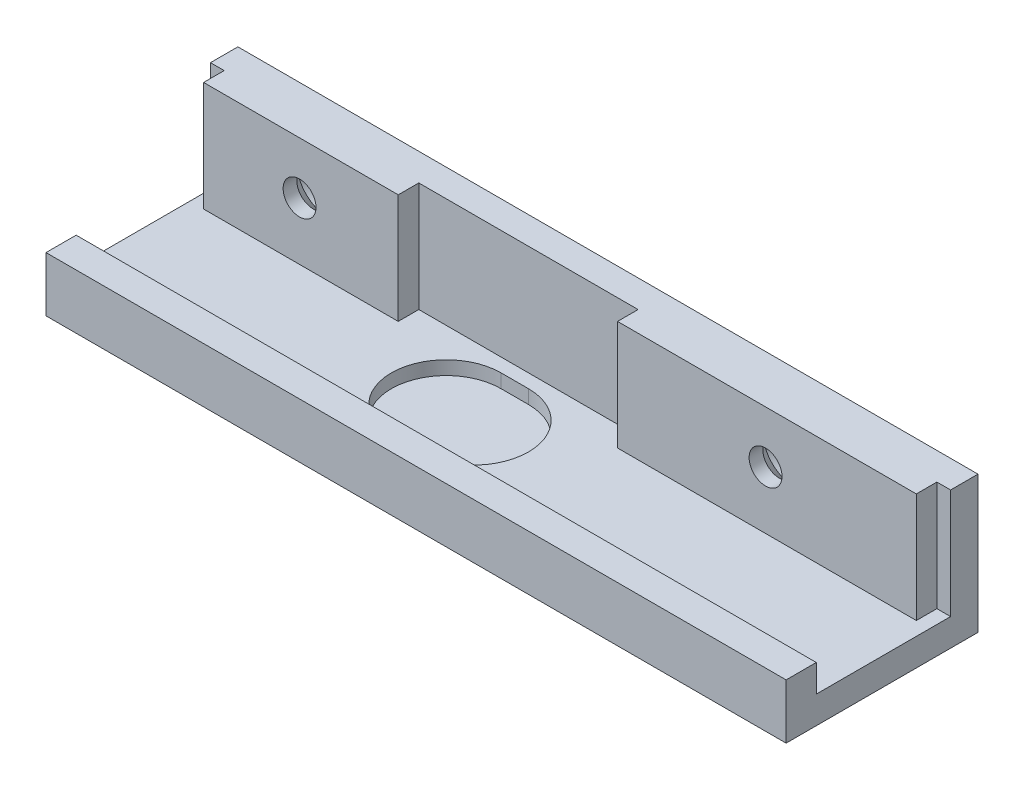
from build123d import *

# Parameters (mm, degrees)
SKETCH2_W                           = 68.58
SKETCH2_H                           = 17.78
BOSS_EXTRUDE1_DEPTH                 = 2.54
SKETCH3_W                           = 68.58
SKETCH3_H                           = 2.54
BOSS_EXTRUDE2_DEPTH                 = 2.54
BOSS_EXTRUDE3_DEPTH                 = 10.16
SKETCH5_R                           = 1.524
CUT_EXTRUDE1_DEPTH                  = 72.009355898
CUT_EXTRUDE2_START                  = -3.81
SKETCH6_R                           = 2.921
CUT_EXTRUDE2_DEPTH                  = 68.199355898
CHAMFER1_SIZE                       = 2.54
CUT_EXTRUDE3_DEPTH                  = 1.27
SKETCH8_W                           = 68.58
SKETCH8_H                           = 2.54
EXTRA_WIDTH_FOR_MIRRORED_PART_DEPTH = 0.254


with BuildPart() as part:
    # Sketch2 → Boss-Extrude1 (new body)
    with BuildSketch(Plane(origin=(0, 0, 0), x_dir=(1, 0, 0), z_dir=(0, 1, 0))):
        with Locations((34.29, -8.89)):
            Rectangle(SKETCH2_W, SKETCH2_H)
    extrude(amount=BOSS_EXTRUDE1_DEPTH)

    # Sketch3 → Boss-Extrude2 (add)
    with BuildSketch(Plane(origin=(0, 2.54, 0), x_dir=(1, 0, 0), z_dir=(0, 1, 0))):
        with Locations((34.29, -16.51)):
            Rectangle(SKETCH3_W, SKETCH3_H)
    extrude(amount=BOSS_EXTRUDE2_DEPTH)

    # Sketch4 → Boss-Extrude3 (add)
    with BuildSketch(Plane(origin=(0, 2.54, 0), x_dir=(1, 0, 0), z_dir=(0, 1, 0))):
        Polygon((0, 0), (68.58, 0), (68.58, -2.54), (67.31, -2.54), (67.31, -4.445), (39.624, -4.445), (39.624, -2.54), (19.304, -2.54), (19.304, -4.445), (1.27, -4.445), (1.27, -2.54), (0, -2.54), align=None)
    extrude(amount=BOSS_EXTRUDE3_DEPTH)

    # Sketch5 → Cut-Extrude1 (cut, through all)
    with BuildSketch(Plane.XY.offset(4.445)):
        with Locations((10.16, 7.874)):
            Circle(SKETCH5_R)
        with Locations((53.34, 7.874)):
            Circle(SKETCH5_R)
    extrude(amount=-CUT_EXTRUDE1_DEPTH, mode=Mode.SUBTRACT)

    # Sketch6 → Cut-Extrude2 (cut, through all)
    with BuildSketch(Plane.XY.offset(4.445).offset(CUT_EXTRUDE2_START)):
        with Locations((10.16, 7.874)):
            Circle(SKETCH6_R)
        with Locations((53.34, 7.874)):
            Circle(SKETCH6_R)
    extrude(amount=-CUT_EXTRUDE2_DEPTH, mode=Mode.SUBTRACT)

    # Chamfer1
    # the kernel refuses this chamfer: 2.54 mm, written as the material it takes off along each edge
    with BuildSketch(Plane(origin=(53.34, 7.874, 0.635), x_dir=(1, 0, 0), z_dir=(0, -1, 0))) as chamfer1_piece_1_section:
        Polygon((1.524 + CHAMFER1_SIZE, 0), (1.524, CHAMFER1_SIZE), (1.524, 0), align=None)
    chamfer1_piece_1 = revolve(axis=Axis((53.34, 7.874, 0.635), (0, 0, 1)), mode=Mode.PRIVATE)
    chamfer1_piece_1 = chamfer1_piece_1 & Plane(origin=(53.34, 7.874, 2.488878995), x_dir=(1, 0, 0), z_dir=(0, 0, 1)) * Cylinder(2.921, 17, mode=Mode.PRIVATE)
    add(chamfer1_piece_1, mode=Mode.SUBTRACT)
    with BuildSketch(Plane(origin=(10.16, 7.874, 0.635), x_dir=(1, 0, 0), z_dir=(0, -1, 0))) as chamfer1_piece_2_section:
        Polygon((1.524 + CHAMFER1_SIZE, 0), (1.524, CHAMFER1_SIZE), (1.524, 0), align=None)
    chamfer1_piece_2 = revolve(axis=Axis((10.16, 7.874, 0.635), (0, 0, 1)), mode=Mode.PRIVATE)
    chamfer1_piece_2 = chamfer1_piece_2 & Plane(origin=(10.16, 7.874, 2.488878995), x_dir=(1, 0, 0), z_dir=(0, 0, 1)) * Cylinder(2.921, 17, mode=Mode.PRIVATE)
    add(chamfer1_piece_2, mode=Mode.SUBTRACT)

    # Sketch7 → Cut-Extrude3 (cut)
    with BuildSketch(Plane(origin=(0, 2.54, 0), x_dir=(1, 0, 0), z_dir=(0, 1, 0))):
        with BuildLine():
            Line((28.194, -3.81), (30.734, -3.81))
            ThreePointArc((30.734, -3.81), (35.814, -8.89), (30.734, -13.97))
            Line((30.734, -13.97), (28.194, -13.97))
            ThreePointArc((28.194, -13.97), (23.114, -8.89), (28.194, -3.81))
        make_face()
    extrude(amount=-CUT_EXTRUDE3_DEPTH, mode=Mode.SUBTRACT)

    # Sketch8 → Extra_width_for_mirrored_part (add)
    with BuildSketch(Plane(origin=(0, 0, 15.24), x_dir=(-1, 0, 0), z_dir=(0, 0, -1))):
        with Locations((-34.29, 3.81)):
            Rectangle(SKETCH8_W, SKETCH8_H)
    extrude(amount=EXTRA_WIDTH_FOR_MIRRORED_PART_DEPTH)


solid = part.part
